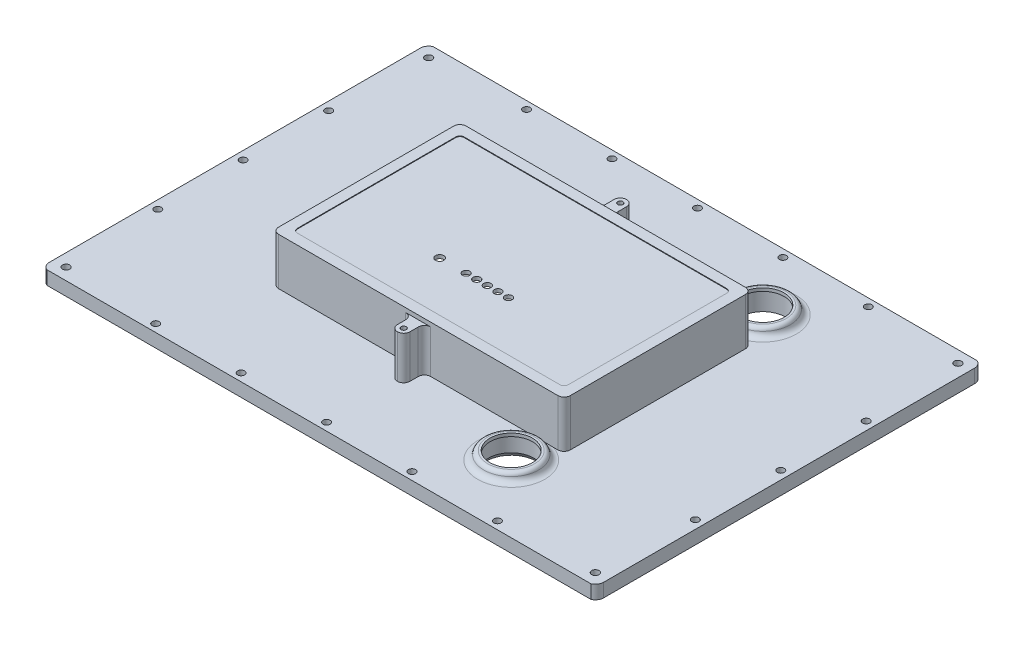
from build123d import *

# Parameters (mm, degrees)
BOSS_EXTRUDE1_DEPTH      = 1.5
FILLET1_R                = 4
BOSS_EXTRUDE4_DEPTH      = 22.6
CUT_EXTRUDE3_DEPTH       = 22.1
FILLET3_R                = 3
SKETCH9_R                = 13.199999999999989
SKETCH9_R_2              = 10.199999999999998
BOSS_EXTRUDE5_DEPTH      = 4
FILLET4_R                = 2
FILLET5_R                = 3
FILLET4_OF_MIRROR2_R     = 2
FILLET5_OF_MIRROR2_R     = 3
BOSS_EXTRUDE7_DEPTH      = 8
SKETCH15_R               = 3.9999999999999933
BOSS_EXTRUDE8_DEPTH      = 5
MIRROR4_COPY_1_DEPTH     = 8
MIRROR4_COPY_2_SKETCH_R  = 3.9999999999999933
MIRROR4_COPY_2_DEPTH     = 5
BOSS_EXTRUDE9_DEPTH      = 6.5
MIRROR6_COPY_1_DEPTH     = 6.5
CUT_EXTRUDE8_START       = -3
SKETCH18_R               = 10.199999999999998
CUT_EXTRUDE8_DEPTH       = 3
CUT_EXTRUDE9_DEPTH       = 10
SKETCH20_R               = 10.999999999999991
CUT_EXTRUDE10_DEPTH      = 4
BOSS_EXTRUDE10_START     = 5
SKETCH21_R               = 13.999999999999998
SKETCH21_R_2             = 10.999999999999991
BOSS_EXTRUDE10_DEPTH     = 5
CHAMFER2_SIZE            = 1
CHAMFER2_SIZE2           = 1.7320508075688867
SKETCH22_R               = 1.7000000000000053
CUT_EXTRUDE11_DEPTH      = 10
LPATTERN1_COUNT          = 3
LPATTERN1_PITCH          = 41
LPATTERN1_COL_COUNT      = 3
LPATTERN1_COL_PITCH      = 41
MIRROR13_COPY_1_SKETCH_R = 1.7000000000000053
MIRROR13_COPY_1_DEPTH    = 10
MIRROR13_COPY_2_SKETCH_R = 1.7000000000000053
MIRROR13_COPY_2_DEPTH    = 10
MIRROR13_COPY_3_SKETCH_R = 1.7000000000000053
MIRROR13_COPY_3_DEPTH    = 10
MIRROR13_COPY_4_SKETCH_R = 1.7000000000000053
MIRROR13_COPY_4_DEPTH    = 10
SKETCH24_W               = 6
SKETCH24_H               = 10.000000000000007
BOSS_EXTRUDE11_DEPTH     = 20.6
FILLET8_R                = 3
SKETCH25_R               = 1.2500000000000013
CUT_EXTRUDE13_DEPTH      = 20.6
MIRROR16_START           = 1.5
MIRROR16_OUTLINE_R       = 1.25
MIRROR16_DEPTH           = 20.6
FILLET9_R                = 3
SKETCH26_R               = 3.500000000000001
SKETCH26_R_2             = 1.2499999999999978
SKETCH26_R_3             = 3.4999999999999987
SKETCH26_R_4             = 1.2499999999999913
SKETCH26_R_5             = 3.5000000000000075
SKETCH26_R_6             = 3.4999999999999996
BOSS_EXTRUDE12_DEPTH     = 5
CUT_EXTRUDE14_DEPTH      = 0.3
SKETCH29_R               = 2.0000000000000036
SKETCH29_R_2             = 1.7500000000000047
SKETCH29_R_3             = 1.7500000000000013
SKETCH29_R_4             = 1.750000000000002
SKETCH29_R_5             = 1.7500000000000004
CUT_EXTRUDE15_DEPTH      = 167.0421934328742
FILLET11_R               = 2
MIRROR17_COPY_1_SKETCH_R = 1.7000000000000053
MIRROR17_COPY_1_DEPTH    = 10
MIRROR17_COPY_2_SKETCH_R = 1.7000000000000053
MIRROR17_COPY_2_DEPTH    = 10
MIRROR17_COPY_3_SKETCH_R = 1.7000000000000053
MIRROR17_COPY_3_DEPTH    = 10
MIRROR17_COPY_4_SKETCH_R = 1.7000000000000053
MIRROR17_COPY_4_DEPTH    = 10
MIRROR17_COPY_5_SKETCH_R = 1.7000000000000053
MIRROR17_COPY_5_DEPTH    = 10
SKETCH36_W               = 277.96087892102145
SKETCH36_H               = 38.65126137270636
CUT_EXTRUDE20_DEPTH      = 0.3
SKETCH37_R               = 1.7000000000000146
SKETCH37_R_2             = 1.7000000000000015
SKETCH37_R_3             = 1.7000000000000188
SKETCH37_R_4             = 1.7000000000000082
BOSS_EXTRUDE15_DEPTH     = 5
BOSS_EXTRUDE16_DEPTH     = 6.5
SKETCH40_R               = 1.7000000000000133
SKETCH40_R_2             = 1.7000000000000126
CUT_EXTRUDE21_DEPTH      = 164.68582713393369
SKETCH41_R               = 1.7500000000000104
CUT_EXTRUDE22_DEPTH      = 10
MIRROR28_COPY_1_SKETCH_R = 1.7500000000000104
MIRROR28_COPY_1_DEPTH    = 10
BOSS_EXTRUDE17_START     = 5
BOSS_EXTRUDE17_DEPTH     = 5
FILLET12_R               = 3
MIRROR31_START           = 5
MIRROR31_COPY_1_DEPTH    = 5
FILLET13_R               = 3
BOSS_EXTRUDE18_DEPTH     = 5
FILLET14_R               = 3


# Read off the part's stored shape, not the designer's step: Mirror16
# Some blends are built 0.0001 mm under size
with BuildPart() as part:
    # Sketch1 → Boss-Extrude1 (new body)
    with BuildSketch(Plane(origin=(0, 0, 0), x_dir=(1, 0, 0), z_dir=(0, 1, 0))):
        Polygon((-132.99999999999997, 92.99999999999997), (133.00000000000003, 92.99999999999997), (133.00000000000006, -93.00000000000003), (-132.99999999999997, -93.00000000000003), align=None)
    extrude(amount=BOSS_EXTRUDE1_DEPTH)

    # Fillet1
    fillet1_edges = [part.edges().sort_by_distance(p)[0] for p in [
        (133.00000000000006, 0.75, 93.00000000000003),
        (-132.99999999999997, 0.75, 93.00000000000003),
        (-132.99999999999997, 0.75, -92.99999999999997),
        (133.00000000000003, 0.75, -92.99999999999997),
    ]]
    fillet(fillet1_edges, radius=FILLET1_R)

    # Sketch7 → Boss-Extrude4 (add)
    with BuildSketch(Plane(origin=(0, 1.5, 0), x_dir=(1, 0, 0), z_dir=(0, 1, 0))):
        Polygon((-70.00000000000001, 45), (69.99999999999999, 45), (70, -45), (-69.99999999999999, -45), align=None)
    extrude(amount=BOSS_EXTRUDE4_DEPTH)

    # Sketch8 → Cut-Extrude3 (cut)
    with BuildSketch(Plane.XZ):
        Polygon((67.99999999999999, -43), (67.99999999999999, 43), (-67.99999999999999, 43), (-68.00000000000001, -43), align=None)
    extrude(amount=-CUT_EXTRUDE3_DEPTH, mode=Mode.SUBTRACT)

    # Fillet3
    fillet3_edges = [part.edges().sort_by_distance(p)[0] for p in [
        (-69.99999999999999, 12.8, 45),
        (-70.00000000000001, 12.8, -45),
        (69.99999999999999, 12.8, -45),
        (70, 12.8, 45),
    ]]
    fillet(fillet3_edges, radius=FILLET3_R)

    # Sketch9 → Boss-Extrude5 (add)
    with BuildSketch(Plane(origin=(0, 1.5, 0), x_dir=(1, 0, 0), z_dir=(0, 1, 0))):
        with Locations(Location((60.000000000000014, -60.375000000000014, 0), (0, 0, 270))):
            Circle(SKETCH9_R)
        with Locations(Location((60.000000000000014, -60.375000000000014, 0), (0, 0, 270))):
            Circle(SKETCH9_R_2, mode=Mode.SUBTRACT)
    boss_extrude5 = extrude(amount=BOSS_EXTRUDE5_DEPTH)

    # Fillet4
    fillet4_edges = [part.edges().sort_by_distance(p)[0] for p in [
        (60.00000000000002, 5.5, 47.175000000000026),
    ]]
    fillet(fillet4_edges, radius=FILLET4_R)

    # Fillet5
    # the kernel refuses this fillet: 3 mm, written as the material it adds along each edge
    with BuildSketch(Plane(origin=(60.000000000000014, 1.5, 60.375000000000014), x_dir=(0, 0, 1), z_dir=(-1, 0, 0))) as fillet5_piece_1:
        with BuildLine():
            CenterArc((16.098979485566346, 3), FILLET5_R, 191.53695903281547, 78.4630409671848)
            Line((16.09897948556636, 0), (16.09897948556636, -0.30000000000000004))
            Line((16.09897948556636, -0.30000000000000004), (13.199999999999989, -0.30000000000000004))
            Line((13.199999999999989, -0.30000000000000004), (12.899999999999991, 0))
            ThreePointArc((12.899999999999991, 0), (12.899999999999991, 2), (12.865653025092541, 2.3400000000000003))
            Line((12.865653025092541, 2.3400000000000003), (13.159591794226529, 2.4000000000000004))
        make_face()
    revolve(axis=Axis((60.000000000000014, 1.5, 60.375000000000014), (0, 1, 0)))

    # Mirror2: Boss-Extrude5 across plane
    add(boss_extrude5.mirror(Plane.XY))

    # Fillet4 of Mirror2
    fillet4_of_mirror2_edges = [part.edges().sort_by_distance(p)[0] for p in [
        (60.00000000000002, 5.5, -47.175000000000026),
    ]]
    fillet(fillet4_of_mirror2_edges, radius=FILLET4_OF_MIRROR2_R)

    # Fillet5 of Mirror2
    # the kernel refuses this fillet: 3 mm, written as the material it adds along each edge
    with BuildSketch(Plane(origin=(60.000000000000014, 1.5, -60.375000000000014), x_dir=(0, 0, -1), z_dir=(-1, 0, 0))) as fillet5_of_mirror2_piece_1:
        with BuildLine():
            CenterArc((16.098979485566346, -3), FILLET5_OF_MIRROR2_R, 89.99999999999973, 78.46304096718478)
            Line((16.09897948556636, 0), (16.09897948556636, 0.30000000000000004))
            Line((16.09897948556636, 0.30000000000000004), (13.199999999999989, 0.30000000000000004))
            Line((13.199999999999989, 0.30000000000000004), (12.899999999999991, 0))
            ThreePointArc((12.899999999999991, 0), (12.899999999999991, -2), (12.865653025092541, -2.3400000000000003))
            Line((12.865653025092541, -2.3400000000000003), (13.159591794226529, -2.4000000000000004))
        make_face()
    revolve(axis=Axis((60.000000000000014, 1.5, -60.375000000000014), (0, -1, 0)))

    # Sketch14 → Boss-Extrude7 (add)
    with BuildSketch(Plane.XZ):
        with BuildLine():
            ThreePointArc((109.99836386815797, 81.58714124971797), (114.26204423855968, 73.23950221163369), (123.03158569416244, 69.92933749223342))
            ThreePointArc((123.03158569416244, 69.92933749223342), (126.99987529104652, 73.96079847744232), (122.9684143058376, 77.9290880743264))
            ThreePointArc((122.9684143058376, 77.9290880743264), (119.59551374599037, 79.20222835101882), (117.95563668045125, 82.41285875028201))
            ThreePointArc((117.95563668045125, 82.41285875028201), (113.56414152402257, 85.97863640614663), (109.99836386815797, 81.58714124971797))
        make_face()
    boss_extrude7 = extrude(amount=BOSS_EXTRUDE7_DEPTH)

    # Sketch15 → Boss-Extrude8 (add)
    with BuildSketch(Plane.XZ.offset(8.00000000000001)):
        with Locations(Location((116.92877899227504, 76.22086528132624, 0), (0, 0, 48.188376622))):
            Circle(SKETCH15_R)
    boss_extrude8 = extrude(amount=BOSS_EXTRUDE8_DEPTH)

    # Mirror3: Boss-Extrude7, Boss-Extrude8 across plane
    add(boss_extrude7.mirror(Plane.XY))
    add(boss_extrude8.mirror(Plane.XY))

    # Mirror4: Boss-Extrude7, Boss-Extrude8 across plane
    add(boss_extrude7.mirror(Plane(origin=(0, 0, 0), x_dir=(0, 0, 1), z_dir=(1, 0, 0))))
    add(boss_extrude8.mirror(Plane(origin=(0, 0, 0), x_dir=(0, 0, 1), z_dir=(1, 0, 0))))

    # Mirror4 copy 1 sketch → Mirror4 copy 1 (add)
    with BuildSketch(Plane(origin=(0, 0, 0), x_dir=(-1, 0, 0), z_dir=(0, -1, 0))):
        with BuildLine():
            ThreePointArc((109.99836386815797, 81.58714124971797), (114.26204423855968, 73.23950221163369), (123.03158569416244, 69.92933749223342))
            ThreePointArc((123.03158569416244, 69.92933749223342), (126.99987529104652, 73.96079847744232), (122.9684143058376, 77.9290880743264))
            ThreePointArc((122.9684143058376, 77.9290880743264), (119.59551374599037, 79.20222835101882), (117.95563668045125, 82.41285875028201))
            ThreePointArc((117.95563668045125, 82.41285875028201), (113.56414152402257, 85.97863640614663), (109.99836386815797, 81.58714124971797))
        make_face()
    extrude(amount=MIRROR4_COPY_1_DEPTH)

    # Mirror4 copy 2 sketch → Mirror4 copy 2 (add)
    with BuildSketch(Plane(origin=(0, -8.00000000000001, 0), x_dir=(-1, 0, 0), z_dir=(0, -1, 0))):
        with Locations(Location((116.92877899227504, 76.22086528132624, 0), (0, 0, 48.188376622))):
            Circle(MIRROR4_COPY_2_SKETCH_R)
    extrude(amount=MIRROR4_COPY_2_DEPTH)

    # Sketch16 → Boss-Extrude9 (add)
    with BuildSketch(Plane(origin=(0, 1.5, 0), x_dir=(1, 0, 0), z_dir=(0, 1, 0))):
        with BuildLine():
            Line((-102.99999999999996, 92.99999999999997), (-128.99999999999997, 92.99999999999997))
            ThreePointArc((-128.99999999999997, 92.99999999999997), (-131.82842712474616, 91.82842712474616), (-132.99999999999997, 88.99999999999997))
            Line((-132.99999999999997, 88.99999999999997), (-132.99999999999997, 62.99999999999997))
            ThreePointArc((-132.99999999999997, 62.99999999999997), (-111.78679656440353, 71.78679656440353), (-102.99999999999996, 92.99999999999997))
        make_face()
    boss_extrude9 = extrude(amount=-BOSS_EXTRUDE9_DEPTH)

    # Mirror5: Boss-Extrude9 across plane
    add(boss_extrude9.mirror(Plane(origin=(0, 0, 0), x_dir=(0, 0, 1), z_dir=(1, 0, 0))))

    # Mirror6: Boss-Extrude9 across plane
    add(boss_extrude9.mirror(Plane.XY))

    # Mirror6 copy 1 sketch → Mirror6 copy 1 (add)
    with BuildSketch(Plane(origin=(0, 1.5, 0), x_dir=(-1, 0, 0), z_dir=(0, 1, 0))):
        with BuildLine():
            Line((-102.99999999999996, 92.99999999999997), (-128.99999999999997, 92.99999999999997))
            ThreePointArc((-128.99999999999997, 92.99999999999997), (-131.82842712474616, 91.82842712474616), (-132.99999999999997, 88.99999999999997))
            Line((-132.99999999999997, 88.99999999999997), (-132.99999999999997, 62.99999999999997))
            ThreePointArc((-132.99999999999997, 62.99999999999997), (-111.78679656440353, 71.78679656440353), (-102.99999999999996, 92.99999999999997))
        make_face()
    extrude(amount=-MIRROR6_COPY_1_DEPTH)

    # Sketch18 → Cut-Extrude8 (cut)
    with BuildSketch(Plane(origin=(0, 1.5, 0), x_dir=(1, 0, 0), z_dir=(0, 1, 0)).offset(CUT_EXTRUDE8_START)):
        with Locations(Location((60.000000000000014, -60.375000000000014, 0), (0, 0, 270))):
            Circle(SKETCH18_R)
    cut_extrude8 = extrude(amount=CUT_EXTRUDE8_DEPTH, mode=Mode.SUBTRACT)

    # Mirror9: Cut-Extrude8 across plane
    add(cut_extrude8.mirror(Plane.XY), mode=Mode.SUBTRACT)

    # Sketch19 → Cut-Extrude9 (cut)
    with BuildSketch(Plane.ZY.offset(70)):
        with BuildLine():
            Line((-21.900000000000027, 16.236931771216863), (-21.900000000000027, 9.363068228783094))
            ThreePointArc((-21.900000000000027, 9.363068228783094), (-33.15000000000003, 12.799999999999978), (-21.900000000000027, 16.236931771216863))
        make_face()
    cut_extrude9 = extrude(amount=-CUT_EXTRUDE9_DEPTH, mode=Mode.SUBTRACT)

    # Mirror10: Cut-Extrude9 across plane
    add(cut_extrude9.mirror(Plane.XY), mode=Mode.SUBTRACT)

    # Sketch20 → Cut-Extrude10 (cut)
    with BuildSketch(Plane.XZ):
        with Locations(Location((60.000000000000014, 60.375000000000014, 0), (0, 0, 270))):
            Circle(SKETCH20_R)
    cut_extrude10 = extrude(amount=-CUT_EXTRUDE10_DEPTH, mode=Mode.SUBTRACT)

    # Mirror11: Cut-Extrude10 across plane
    add(cut_extrude10.mirror(Plane.XY), mode=Mode.SUBTRACT)

    # Sketch21 → Boss-Extrude10 (add)
    with BuildSketch(Plane.XZ.offset(BOSS_EXTRUDE10_START)):
        with Locations(Location((60.000000000000014, 60.375000000000014, 0), (0, 0, 90))):
            Circle(SKETCH21_R)
        with Locations(Location((60.000000000000014, 60.375000000000014, 0), (0, 0, 270))):
            Circle(SKETCH21_R_2, mode=Mode.SUBTRACT)
    boss_extrude10 = extrude(amount=-BOSS_EXTRUDE10_DEPTH)

    # Chamfer2
    chamfer2_edges = [part.edges().sort_by_distance(p)[0] for p in [
        (60.000000000000014, -5, 71.375),
    ]]
    chamfer2_side = [part.faces().sort_by_distance(p)[0] for p in [
        (60.000000000000014, -5, 46.770979797464484),
    ]]
    chamfer(chamfer2_edges, length=CHAMFER2_SIZE, length2=CHAMFER2_SIZE2, reference=chamfer2_side[0])

    # Mirror12: Boss-Extrude10 across plane
    add(boss_extrude10.mirror(Plane.XY))

    # Sketch22 → Cut-Extrude11 (cut)
    with BuildSketch(Plane(origin=(0, 1.5, 0), x_dir=(1, 0, 0), z_dir=(0, 1, 0))):
        with Locations(Location((1.388e-14, -89.00000000000003, 0), (0, 0, 270))):
            Circle(SKETCH22_R)
    cut_extrude11 = extrude(amount=-CUT_EXTRUDE11_DEPTH, mode=Mode.SUBTRACT)

    # LPattern1: Cut-Extrude11 ×3
    with Locations(*[(i * LPATTERN1_PITCH, 0, 0) for i in range(1, LPATTERN1_COUNT)]):
        add(cut_extrude11, mode=Mode.SUBTRACT)

    # LPattern1 col: Cut-Extrude11 ×3
    with Locations(*[(-i * LPATTERN1_COL_PITCH, 0, 0) for i in range(1, LPATTERN1_COL_COUNT)]):
        add(cut_extrude11, mode=Mode.SUBTRACT)

    # Mirror13: Cut-Extrude11 across plane
    add(cut_extrude11.mirror(Plane.XY), mode=Mode.SUBTRACT)

    # Mirror13 copy 1 sketch → Mirror13 copy 1 (cut)
    with BuildSketch(Plane(origin=(41, 1.5, 0), x_dir=(1, 0, 0), z_dir=(0, 1, 0))):
        with Locations((1.388e-14, 89.00000000000003)):
            Circle(MIRROR13_COPY_1_SKETCH_R)
    extrude(amount=-MIRROR13_COPY_1_DEPTH, mode=Mode.SUBTRACT)

    # Mirror13 copy 2 sketch → Mirror13 copy 2 (cut)
    with BuildSketch(Plane(origin=(82, 1.5, 0), x_dir=(1, 0, 0), z_dir=(0, 1, 0))):
        with Locations((1.388e-14, 89.00000000000003)):
            Circle(MIRROR13_COPY_2_SKETCH_R)
    extrude(amount=-MIRROR13_COPY_2_DEPTH, mode=Mode.SUBTRACT)

    # Mirror13 copy 3 sketch → Mirror13 copy 3 (cut)
    with BuildSketch(Plane(origin=(-41, 1.5, -1.388e-14), x_dir=(1, 0, 0), z_dir=(0, 1, 0))):
        with Locations((1.388e-14, 89.00000000000003)):
            Circle(MIRROR13_COPY_3_SKETCH_R)
    extrude(amount=-MIRROR13_COPY_3_DEPTH, mode=Mode.SUBTRACT)

    # Mirror13 copy 4 sketch → Mirror13 copy 4 (cut)
    with BuildSketch(Plane(origin=(-82, 1.5, -2.776e-14), x_dir=(1, 0, 0), z_dir=(0, 1, 0))):
        with Locations((1.388e-14, 89.00000000000003)):
            Circle(MIRROR13_COPY_4_SKETCH_R)
    extrude(amount=-MIRROR13_COPY_4_DEPTH, mode=Mode.SUBTRACT)

    # Sketch24 → Boss-Extrude11 (add)
    with BuildSketch(Plane(origin=(0, 1.5, 0), x_dir=(1, 0, 0), z_dir=(0, 1, 0))):
        with Locations((4.263e-14, -50)):
            Rectangle(SKETCH24_W, SKETCH24_H)
    extrude(amount=BOSS_EXTRUDE11_DEPTH)

    # Fillet8
    fillet8_edges = [part.edges().sort_by_distance(p)[0] for p in [
        (3.0000000000000426, 11.8, 45),
    ]]
    fillet(fillet8_edges, radius=FILLET8_R)
    fillet8_2_edges = [part.edges().sort_by_distance(p)[0] for p in [
        (-2.9999999999999574, 11.8, 45),
    ]]
    fillet(fillet8_2_edges, radius=FILLET8_R)
    fillet8_3_edges = [part.edges().sort_by_distance(p)[0] for p in [
        (3.0000000000000426, 11.8, 55),
    ]]
    fillet(fillet8_3_edges, radius=FILLET8_R)
    fillet8_4_edges = [part.edges().sort_by_distance(p)[0] for p in [
        (-2.9999999999999574, 11.8, 55),
    ]]
    fillet(fillet8_4_edges, radius=FILLET8_R - 0.0001)  # a hair under: the kernel refuses the full size

    # Sketch25 → Cut-Extrude13 (cut)
    with BuildSketch(Plane(origin=(0, 22.09999999999995, 0), x_dir=(1, 0, 0), z_dir=(0, 1, 0))):
        with Locations(Location((4.25e-14, -52, 0), (0, 0, 270))):
            Circle(SKETCH25_R)
    extrude(amount=-CUT_EXTRUDE13_DEPTH, mode=Mode.SUBTRACT)

    # Mirror16 outline → Mirror16 (add)
    with BuildSketch(Plane(origin=(0, 0, 0), x_dir=(1, 0, 0), z_dir=(0, 1, 0)).offset(MIRROR16_START)):
        with BuildLine():
            ThreePointArc((0, 55), (-2.121320344, 54.121320344), (-3, 52))
            Line((-3, 52), (-3, 45))
            Line((-3, 45), (3, 45))
            Line((3, 45), (3, 52))
            ThreePointArc((3, 52), (2.121320344, 54.121320344), (0, 55))
        make_face()
        with Locations((0, 52)):
            Circle(MIRROR16_OUTLINE_R, mode=Mode.SUBTRACT)
    extrude(amount=MIRROR16_DEPTH)

    # Fillet9
    fillet9_edges = [part.edges().sort_by_distance(p)[0] for p in [
        (3, 11.8, -45),
        (-3, 11.8, -45),
    ]]
    fillet(fillet9_edges, radius=FILLET9_R)

    # Sketch26 → Boss-Extrude12 (add)
    # profile 1 of 4: a face of its own
    with BuildSketch(Plane.XZ.offset(-22.09999999999995)):
        with Locations(Location((-33.29800507999998, -36.69801015999999, 0), (0, 0, 270))):
            Circle(SKETCH26_R)
        with Locations(Location((-33.29800507999998, -36.69801015999999, 0), (0, 0, 270))):
            Circle(SKETCH26_R_2, mode=Mode.SUBTRACT)
    # profile 2 of 4: a face of its own
    with BuildSketch(Plane.XZ.offset(-22.09999999999995)):
        with Locations(Location((61.69799492000002, -36.69800762000001, 0), (0, 0, 270))):
            Circle(SKETCH26_R_3)
        with Locations(Location((61.69799492000002, -36.69800762000001, 0), (0, 0, 270))):
            Circle(SKETCH26_R_4, mode=Mode.SUBTRACT)
    # profile 3 of 4: a face of its own
    with BuildSketch(Plane.XZ.offset(-22.09999999999995)):
        with Locations(Location((61.69799238000004, 20.197992379999974, 0), (0, 0, 270))):
            Circle(SKETCH26_R_5)
        with Locations(Location((61.69799238000004, 20.197992379999974, 0), (0, 0, 270))):
            Circle(SKETCH26_R_2, mode=Mode.SUBTRACT)
    # profile 4 of 4: a face of its own
    with BuildSketch(Plane.XZ.offset(-22.09999999999995)):
        with Locations(Location((-33.29800507999995, 20.19799492000003, 0), (0, 0, 270))):
            Circle(SKETCH26_R_6)
        with Locations(Location((-33.29800507999995, 20.19799492000003, 0), (0, 0, 270))):
            Circle(SKETCH26_R_2, mode=Mode.SUBTRACT)
    extrude(amount=BOSS_EXTRUDE12_DEPTH)

    # Sketch27 → Cut-Extrude14 (cut)
    with BuildSketch(Plane(origin=(0, 24.09999999999995, 0), x_dir=(1, 0, 0), z_dir=(0, 1, 0))):
        with BuildLine():
            Line((-62.99999999999997, -40), (63, -40))
            ThreePointArc((63, -40), (64.41421356237309, -39.41421356237309), (64.99999999999999, -38))
            Line((64.99999999999999, -38), (64.99999999999999, 38.00000000000001))
            ThreePointArc((64.99999999999999, 38.00000000000001), (64.41421356237308, 39.41421356237309), (63, 40))
            Line((63, 40), (-62.99999999999997, 40))
            ThreePointArc((-62.99999999999997, 40), (-64.41421356237306, 39.41421356237309), (-64.99999999999996, 38))
            Line((-64.99999999999996, 38), (-64.99999999999996, -38))
            ThreePointArc((-64.99999999999996, -38), (-64.41421356237306, -39.41421356237309), (-62.99999999999997, -40))
        make_face()
    extrude(amount=-CUT_EXTRUDE14_DEPTH, mode=Mode.SUBTRACT)

    # Sketch29 → Cut-Extrude15 (cut, through all)
    with BuildSketch(Plane.XZ.offset(-22.09999999999995)):
        with Locations(Location((-18.82008127999997, 15.879918720000012, 0), (0, 0, 270))):
            Circle(SKETCH29_R)
        with Locations(Location((-6.1199999999999735, 15.879989840000011, 0), (0, 0, 270))):
            Circle(SKETCH29_R_2)
        with Locations(Location((-1.0400000000000686, 15.879989840000011, 0), (0, 0, 270))):
            Circle(SKETCH29_R_3)
        with Locations(Location((4.0399999999999325, 15.879989840000011, 0), (0, 0, 270))):
            Circle(SKETCH29_R_4)
        with Locations(Location((9.119999999999933, 15.879989840000011, 0), (0, 0, 270))):
            Circle(SKETCH29_R_5)
        with Locations(Location((14.200002539999923, 15.879989840000011, 0), (0, 0, 270))):
            Circle(SKETCH29_R_5)
    extrude(amount=-CUT_EXTRUDE15_DEPTH, mode=Mode.SUBTRACT)

    # Fillet11
    fillet11_edges = [part.edges().sort_by_distance(p)[0] for p in [
        (67.99999999999999, 11.05, -43),
        (-68.00000000000001, 11.05, -43),
        (-67.99999999999999, 11.05, 43),
        (67.99999999999999, 11.05, 43),
    ]]
    fillet(fillet11_edges, radius=FILLET11_R)

    # Mirror17 copy 1 sketch → Mirror17 copy 1 (cut)
    with BuildSketch(Plane(origin=(41, 1.5, 0), x_dir=(1, 0, 0), z_dir=(0, 1, 0))):
        with Locations((1.388e-14, 89.00000000000003)):
            Circle(MIRROR17_COPY_1_SKETCH_R)
    extrude(amount=-MIRROR17_COPY_1_DEPTH, mode=Mode.SUBTRACT)

    # Mirror17 copy 2 sketch → Mirror17 copy 2 (cut)
    with BuildSketch(Plane(origin=(82, 1.5, 0), x_dir=(1, 0, 0), z_dir=(0, 1, 0))):
        with Locations((1.388e-14, 89.00000000000003)):
            Circle(MIRROR17_COPY_2_SKETCH_R)
    extrude(amount=-MIRROR17_COPY_2_DEPTH, mode=Mode.SUBTRACT)

    # Mirror17 copy 3 sketch → Mirror17 copy 3 (cut)
    with BuildSketch(Plane(origin=(-41, 1.5, -1.388e-14), x_dir=(1, 0, 0), z_dir=(0, 1, 0))):
        with Locations((1.388e-14, 89.00000000000003)):
            Circle(MIRROR17_COPY_3_SKETCH_R)
    extrude(amount=-MIRROR17_COPY_3_DEPTH, mode=Mode.SUBTRACT)

    # Mirror17 copy 4 sketch → Mirror17 copy 4 (cut)
    with BuildSketch(Plane(origin=(-82, 1.5, -2.776e-14), x_dir=(1, 0, 0), z_dir=(0, 1, 0))):
        with Locations((1.388e-14, 89.00000000000003)):
            Circle(MIRROR17_COPY_4_SKETCH_R)
    extrude(amount=-MIRROR17_COPY_4_DEPTH, mode=Mode.SUBTRACT)

    # Mirror17 copy 5 sketch → Mirror17 copy 5 (cut)
    with BuildSketch(Plane(origin=(0, 1.5, 0), x_dir=(1, 0, 0), z_dir=(0, 1, 0))):
        with Locations((1.388e-14, 89.00000000000003)):
            Circle(MIRROR17_COPY_5_SKETCH_R)
    extrude(amount=-MIRROR17_COPY_5_DEPTH, mode=Mode.SUBTRACT)

    # Sketch36 → Cut-Extrude20 (cut)
    with BuildSketch(Plane.XY.offset(93.00000000000003)):
        Rectangle(SKETCH36_W, SKETCH36_H)
    cut_extrude20 = extrude(amount=-CUT_EXTRUDE20_DEPTH, mode=Mode.SUBTRACT)

    # Mirror22: Cut-Extrude20 across plane
    add(cut_extrude20.mirror(Plane.XY), mode=Mode.SUBTRACT)

    # Sketch37 → Boss-Extrude15 (add)
    with BuildSketch(Plane.XZ):
        Polygon((107.1492480151339, -85.30000000000001), (-107.14924801513386, -85.3), (-107.14924801513386, -92.70000000000003), (107.1492480151339, -92.70000000000003), align=None)
        with Locations(Location((-81.99999999999999, -89.00000000000006, 0), (0, 0, 90))):
            Circle(SKETCH37_R, mode=Mode.SUBTRACT)
        with Locations(Location((-40.999999999999986, -89.00000000000004, 0), (0, 0, 90))):
            Circle(SKETCH37_R_2, mode=Mode.SUBTRACT)
        with Locations(Location((2.025e-14, -89.00000000000001, 0), (0, 0, 90))):
            Circle(SKETCH37_R_3, mode=Mode.SUBTRACT)
        with Locations(Location((41.000000000000014, -89.00000000000003, 0), (0, 0, 90))):
            Circle(SKETCH37_R_4, mode=Mode.SUBTRACT)
        with Locations(Location((82.00000000000001, -89.00000000000003, 0), (0, 0, 90))):
            Circle(SKETCH37_R, mode=Mode.SUBTRACT)
    boss_extrude15 = extrude(amount=BOSS_EXTRUDE15_DEPTH)

    # Mirror23: Boss-Extrude15 across plane
    add(boss_extrude15.mirror(Plane.XY))

    # Sketch39 → Boss-Extrude16 (add)
    with BuildSketch(Plane(origin=(0, 1.5, 0), x_dir=(1, 0, 0), z_dir=(0, 1, 0))):
        Polygon((-124.99999999999986, 68.2483050764809), (-132.99999999999997, 68.2483050764809), (-132.99999999999997, -68.24830507647957), (-124.99999999999984, -68.24830507647958), align=None)
    boss_extrude16 = extrude(amount=-BOSS_EXTRUDE16_DEPTH)

    # Sketch40 → Cut-Extrude21 (cut, symmetric)
    with BuildSketch(Plane(origin=(0, 1.5, 0), x_dir=(1, 0, 0), z_dir=(0, 1, 0))):
        with Locations(Location((-129, 0, 0), (0, 0, 270))):
            Circle(SKETCH40_R)
        with Locations(Location((-129.00000000000006, 41, 0), (0, 0, 270))):
            Circle(SKETCH40_R_2)
        with Locations(Location((-129, -41, 0), (0, 0, 270))):
            Circle(SKETCH40_R_2)
    cut_extrude21 = extrude(amount=CUT_EXTRUDE21_DEPTH, both=True, mode=Mode.SUBTRACT)

    # Mirror24: Boss-Extrude16 across plane
    add(boss_extrude16.mirror(Plane(origin=(0, 0, 0), x_dir=(0, 0, 1), z_dir=(1, 0, 0))))

    # Mirror26: Cut-Extrude21 across plane
    add(cut_extrude21.mirror(Plane(origin=(0, 0, 0), x_dir=(0, 0, 1), z_dir=(1, 0, 0))), mode=Mode.SUBTRACT)

    # Sketch41 → Cut-Extrude22 (cut)
    with BuildSketch(Plane(origin=(0, 1.5, 0), x_dir=(1, 0, 0), z_dir=(0, 1, 0))):
        with Locations(Location((-127.00000000000006, -87, 0), (0, 0, 270))):
            Circle(SKETCH41_R)
    cut_extrude22 = extrude(amount=-CUT_EXTRUDE22_DEPTH, mode=Mode.SUBTRACT)

    # Mirror27: Cut-Extrude22 across plane
    add(cut_extrude22.mirror(Plane.XY), mode=Mode.SUBTRACT)

    # Mirror28: Cut-Extrude22 across plane
    add(cut_extrude22.mirror(Plane(origin=(0, 0, 0), x_dir=(0, 0, 1), z_dir=(1, 0, 0))), mode=Mode.SUBTRACT)

    # Mirror28 copy 1 sketch → Mirror28 copy 1 (cut)
    with BuildSketch(Plane(origin=(0, 1.5, 0), x_dir=(-1, 0, 0), z_dir=(0, 1, 0))):
        with Locations(Location((-127.00000000000006, -87, 0), (0, 0, 270))):
            Circle(MIRROR28_COPY_1_SKETCH_R)
    extrude(amount=-MIRROR28_COPY_1_DEPTH, mode=Mode.SUBTRACT)

    # Sketch42 → Boss-Extrude17 (add)
    with BuildSketch(Plane.XZ.offset(BOSS_EXTRUDE17_START)):
        with BuildLine():
            Line((46.072656693333435, 61.79946776665873), (46.072656693333435, 85.3))
            Line((46.072656693333435, 85.3), (49.072656693333435, 85.3))
            Line((49.072656693333435, 85.3), (49.072656693333435, 69.12675229644039))
            ThreePointArc((49.072656693333435, 69.12675229644039), (47.04387649384104, 65.67960777938909), (46.072656693333435, 61.79946776665873))
        make_face()
    boss_extrude17 = extrude(amount=-BOSS_EXTRUDE17_DEPTH)

    # Mirror29: Boss-Extrude17 across plane
    add(boss_extrude17.mirror(Plane(origin=(60.000000000000014, 0, 0), x_dir=(0, 0, 1), z_dir=(1, 0, 0))))

    # Fillet12
    fillet12_edges = [part.edges().sort_by_distance(p)[0] for p in [
        (49.072656693333435, -2.5, 69.12675229644039),
        (49.072656693333435, -2.5, 85.3),
        (70.92734330666659, -2.5, 85.3),
        (70.92734330666659, -2.5, 69.12675229644039),
    ]]
    fillet(fillet12_edges, radius=FILLET12_R)

    # Mirror31: Boss-Extrude17 across plane
    add(boss_extrude17.mirror(Plane.XY))

    # Mirror31 copy 1 sketch → Mirror31 copy 1 (add)
    with BuildSketch(Plane(origin=(120.00000000000003, 0, 0), x_dir=(-1, 0, 0), z_dir=(0, -1, 0)).offset(MIRROR31_START)):
        with BuildLine():
            Line((46.072656693333435, 61.79946776665873), (46.072656693333435, 85.3))
            Line((46.072656693333435, 85.3), (49.072656693333435, 85.3))
            Line((49.072656693333435, 85.3), (49.072656693333435, 69.12675229644039))
            ThreePointArc((49.072656693333435, 69.12675229644039), (47.04387649384104, 65.67960777938909), (46.072656693333435, 61.79946776665873))
        make_face()
    extrude(amount=-MIRROR31_COPY_1_DEPTH)

    # Fillet13
    fillet13_edges = [part.edges().sort_by_distance(p)[0] for p in [
        (49.072656693333435, -2.5, -85.3),
        (49.072656693333435, -2.5, -69.12675229644039),
        (70.92734330666659, -2.5, -69.12675229644039),
        (70.92734330666659, -2.5, -85.3),
    ]]
    fillet(fillet13_edges, radius=FILLET13_R)

    # Sketch43 → Boss-Extrude18 (add)
    with BuildSketch(Plane.XZ):
        Polygon((124.99999999999986, -43), (-124.99999999999983, -43), (-124.99999999999983, -46.49999999999999), (124.99999999999983, -46.49999999999999), align=None)
    extrude(amount=BOSS_EXTRUDE18_DEPTH)

    # Fillet14
    fillet14_edges = [part.edges().sort_by_distance(p)[0] for p in [
        (61.86664806538335, -2.5, -46.49999999999999),
    ]]
    fillet(fillet14_edges, radius=FILLET14_R)


solid = part.part
